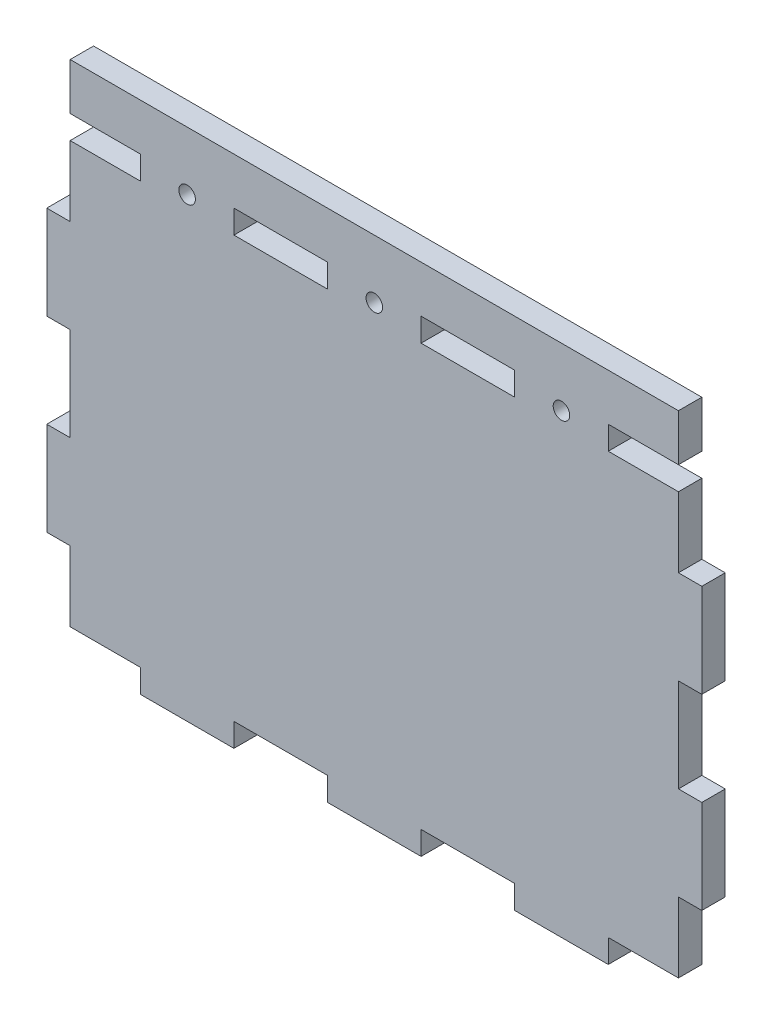
from build123d import *

# Parameters (mm, degrees)
SKETCH1_W                 = 177.8
SKETCH1_H                 = 139.7
BOSS_EXTRUDE1_DEPTH       = 6.35
SKETCH5_W                 = 6.35
SKETCH5_H                 = 25.4
CUT_EXTRUDE4_DEPTH        = 6.35
SKETCH6_W                 = 25.4
SKETCH6_H                 = 6.35
CUT_EXTRUDE5_DEPTH        = 6.35
LPATTERN5_COUNT           = 3
LPATTERN5_PITCH           = 50.8
LPATTERN5_COUNT_DIR2      = 2
LPATTERN5_PITCH_DIR2      = 171.45
LPATTERN6_COUNT           = 4
LPATTERN6_PITCH           = 50.8
LPATTERN6_COUNT_DIR2      = 2
LPATTERN6_PITCH_DIR2      = 120.65
SKETCH7_W                 = 6.35
SKETCH7_H                 = 19.05
SKETCH7_H_2               = 12.7
CUT_EXTRUDE6_DEPTH        = 6.35
F_8_CLEARANCE_HOLE1_D     = 4.4958
F_8_CLEARANCE_HOLE1_DEPTH = 10.16
F_8_CLEARANCE_HOLE1_TIP   = 1.350674586


with BuildPart() as part:
    # Sketch1 → Boss-Extrude1 (new body)
    with BuildSketch(Plane.XY):
        with Locations((88.9, 69.85)):
            Rectangle(SKETCH1_W, SKETCH1_H)
    extrude(amount=BOSS_EXTRUDE1_DEPTH)

    # Sketch5 → Cut-Extrude4 (cut)
    with BuildSketch(Plane.XY.offset(6.35)):
        with Locations((3.175, 12.7)):
            Rectangle(SKETCH5_W, SKETCH5_H)
    cut_extrude4 = extrude(amount=-CUT_EXTRUDE4_DEPTH, mode=Mode.SUBTRACT)

    # Sketch6 → Cut-Extrude5 (cut)
    with BuildSketch(Plane.XY.offset(6.35)):
        with Locations((12.7, 3.175)):
            Rectangle(SKETCH6_W, SKETCH6_H)
    cut_extrude5 = extrude(amount=-CUT_EXTRUDE5_DEPTH, mode=Mode.SUBTRACT)

    # LPattern5: Cut-Extrude4 3 × 2
    with Locations(*[(j * LPATTERN5_PITCH_DIR2, i * LPATTERN5_PITCH, 0) for i in range(LPATTERN5_COUNT) for j in range(LPATTERN5_COUNT_DIR2) if (i, j) != (0, 0)]):
        add(cut_extrude4, mode=Mode.SUBTRACT)

    # LPattern6: Cut-Extrude5 4 × 2
    with Locations(*[(i * LPATTERN6_PITCH, j * LPATTERN6_PITCH_DIR2, 0) for i in range(LPATTERN6_COUNT) for j in range(LPATTERN6_COUNT_DIR2) if (i, j) != (0, 0)]):
        add(cut_extrude5, mode=Mode.SUBTRACT)

    # Sketch7 → Cut-Extrude6 (cut)
    with BuildSketch(Plane.XY.offset(6.35)):
        with Locations((3.175, 130.175)):
            Rectangle(SKETCH7_W, SKETCH7_H)
        with Locations((174.625, 133.35)):
            Rectangle(SKETCH7_W, SKETCH7_H_2)
    extrude(amount=-CUT_EXTRUDE6_DEPTH, mode=Mode.SUBTRACT)

    # #8 Clearance Hole1
    with Locations(Plane.XY.offset(6.35)):
        with Locations((38.1, 123.825), (88.9, 123.825), (139.7, 123.825)):
            Hole(F_8_CLEARANCE_HOLE1_D / 2, depth=F_8_CLEARANCE_HOLE1_DEPTH)
            with Locations((0, 0, -(F_8_CLEARANCE_HOLE1_DEPTH + F_8_CLEARANCE_HOLE1_TIP / 2))):  # 118° drill point
                Cone(0, F_8_CLEARANCE_HOLE1_D / 2, F_8_CLEARANCE_HOLE1_TIP, mode=Mode.SUBTRACT)


solid = part.part
